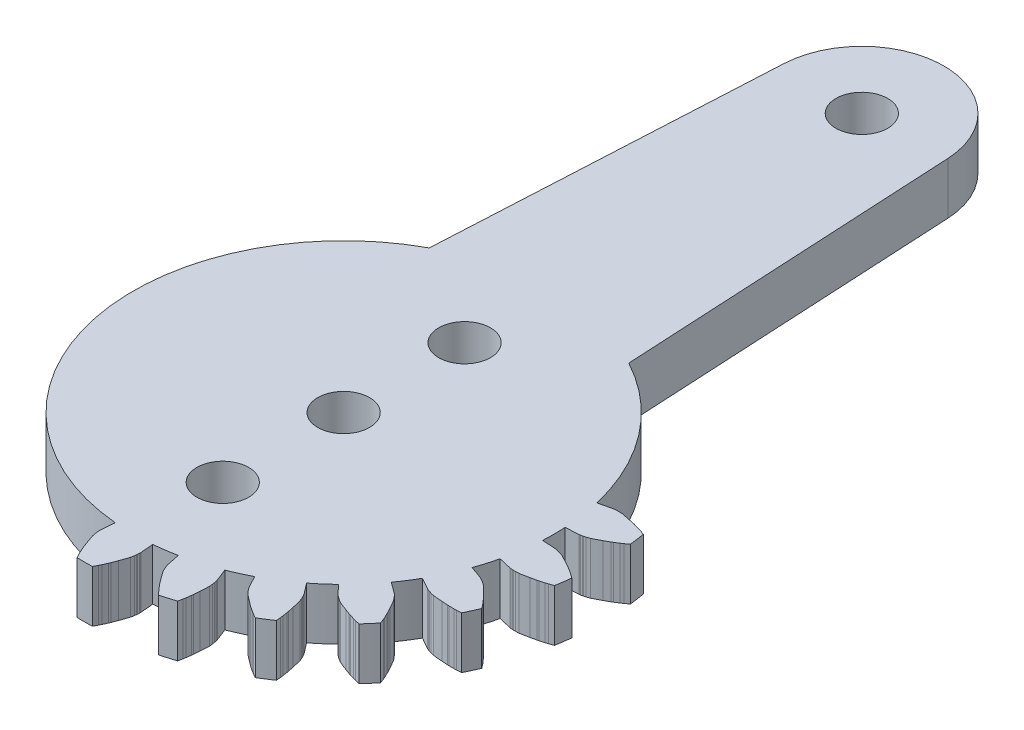
from build123d import *

# Parameters (mm, degrees)
EXTRUDE_1_DEPTH          = 3
SKETCH_2_R               = 12.1875
SKETCH_2_R_2             = 1.5
EXTRUDE_2_DEPTH          = 3
PATTERN_CIRCULAR_2_COUNT = 22
SKETCH_5_R               = 1.5
EXTRUDE_3_DEPTH          = 3
CUT_EXTRUDE_1_DEPTH      = 3


with BuildPart() as part:
    # 草图1 → 凸台-拉伸1 (new body)
    with BuildSketch(Plane(origin=(0, 0, 0), x_dir=(1, 0, 0), z_dir=(0, 1, 0))):
        with BuildLine():
            Line((39.751048724, 40.522419067), (39.686554084, 41.267856945))
            Line((39.686554084, 41.267856945), (39.685130687, 41.328679419))
            Line((39.685130687, 41.328679419), (39.685864546, 41.357680475))
            Line((39.685864546, 41.357680475), (39.691646479, 41.452849434))
            Line((39.691646479, 41.452849434), (39.692944909, 41.469767126))
            Line((39.692944909, 41.469767126), (39.696597708, 41.504162575))
            Line((39.696597708, 41.504162575), (39.712000694, 41.625842063))
            Line((39.712000694, 41.625842063), (39.748222719, 41.824728347))
            ThreePointArc((39.748222719, 41.824728347), (39.836788564, 42.08141601), (39.929464983, 42.336648348))
            Line((39.929464983, 42.336648348), (40.043958498, 42.644244873))
            Line((40.043958498, 42.644244873), (40.045380324, 42.647784709))
            Line((40.045380324, 42.647784709), (40.085544561, 42.739845233))
            Line((40.085544561, 42.739845233), (40.199519113, 42.997146045))
            ThreePointArc((40.199519113, 42.997146045), (40.23147084, 43.066367201), (40.265346714, 43.134667321))
            ThreePointArc((40.265346714, 43.134667321), (40.328973011, 43.256230012), (40.394481299, 43.376788951))
            ThreePointArc((40.394481299, 43.376788951), (40.835680824, 43.383278913), (41.276880349, 43.376788932))
            ThreePointArc((41.276880349, 43.376788932), (41.342388638, 43.256229993), (41.406014935, 43.134667302))
            ThreePointArc((41.406014935, 43.134667302), (41.439890808, 43.066367181), (41.471842535, 42.997146026))
            Line((41.471842535, 42.997146026), (41.585817087, 42.739845214))
            Line((41.585817087, 42.739845214), (41.625981324, 42.647784689))
            Line((41.625981324, 42.647784689), (41.62740315, 42.644244854))
            Line((41.62740315, 42.644244854), (41.741896665, 42.336648329))
            ThreePointArc((41.741896665, 42.336648329), (41.834572754, 42.081415998), (41.923138271, 41.824728347))
            Line((41.923138271, 41.824728347), (41.959360296, 41.625842063))
            Line((41.959360296, 41.625842063), (41.974763282, 41.504162575))
            Line((41.974763282, 41.504162575), (41.978416081, 41.469767126))
            Line((41.978416081, 41.469767126), (41.979714511, 41.452849434))
            Line((41.979714511, 41.452849434), (41.985496444, 41.357680475))
            Line((41.985496444, 41.357680475), (41.986230303, 41.328679419))
            Line((41.986230303, 41.328679419), (41.984806906, 41.267856945))
            Line((41.984806906, 41.267856945), (41.920312266, 40.522419067))
            ThreePointArc((41.920312266, 40.522419067), (40.835680495, 40.570778645), (39.751048724, 40.522419067))
        make_face()
    extrude_1 = extrude(amount=EXTRUDE_1_DEPTH)

    # 草图2 → 凸台-拉伸2 (add)
    with BuildSketch(Plane.XZ):
        with Locations((40.835680495, -28.383278645)):
            Circle(SKETCH_2_R)
        with Locations((40.835680495, -28.383278645)):
            Circle(SKETCH_2_R_2, mode=Mode.SUBTRACT)
        with Locations((40.835680495, -21.383278645)):
            Circle(SKETCH_2_R_2, mode=Mode.SUBTRACT)
        with Locations((40.835680495, -35.383278645)):
            Circle(SKETCH_2_R_2, mode=Mode.SUBTRACT)
    extrude(amount=-EXTRUDE_2_DEPTH)

    # 阵列(圆周)2: 凸台-拉伸1 ×22 about axis
    pattern_circular_2_axis = Axis((40.835680495, 3, -28.383278645), (0, -1, 0))
    for i in range(1, PATTERN_CIRCULAR_2_COUNT):
        add(extrude_1.rotate(pattern_circular_2_axis, i * 360 / PATTERN_CIRCULAR_2_COUNT))

    # 草图5 → 凸台-拉伸3 (add)
    with BuildSketch(Plane.XZ):
        with BuildLine():
            Line((45.585680495, -58.632739942), (46.610680495, -39.115684305))
            ThreePointArc((46.610680495, -39.115684305), (40.835680495, -40.570778645), (35.060680495, -39.115684305))
            Line((35.060680495, -39.115684305), (36.085680495, -58.632739942))
            ThreePointArc((36.085680495, -58.632739942), (40.835680495, -63.13982476), (45.585680495, -58.632739942))
        make_face()
        with Locations((40.835680495, -58.383278645)):
            Circle(SKETCH_5_R, mode=Mode.SUBTRACT)
    extrude(amount=-EXTRUDE_3_DEPTH)

    # 草图7 → 切除-拉伸1 (cut)
    with BuildSketch(Plane.XZ):
        with BuildLine():
            Line((35.060680495, -39.115684305), (35.075125418, -39.390730508))
            Line((35.075125418, -39.390730508), (34.836458203, -39.843740301))
            Line((34.836458203, -39.843740301), (33.621076182, -45.069775655))
            Line((33.621076182, -45.069775655), (23.29469854, -35.421541283))
            Line((23.29469854, -35.421541283), (25.189109524, -22.168156693))
            Line((25.189109524, -22.168156693), (31.430752441, -11.204000881))
            Line((31.430752441, -11.204000881), (37.969616449, -9.816969122))
            Line((37.969616449, -9.816969122), (39.751048724, -16.244138224))
            ThreePointArc((39.751048724, -16.244138224), (28.89664611, -25.93488852), (35.060680495, -39.115684305))
        make_face()
        with BuildLine():
            Line((46.610680495, -39.115684305), (46.596235572, -39.390730508))
            Line((46.596235572, -39.390730508), (47.014217925, -42.363226189))
            Line((47.014217925, -42.363226189), (53.527706743, -41.712847694))
            Line((53.527706743, -41.712847694), (55.437535773, -32.439444059))
            Line((55.437535773, -32.439444059), (52.32840334, -32.439444059))
            ThreePointArc((52.32840334, -32.439444059), (50.09238666, -36.31098621), (46.610680495, -39.115684305))
        make_face()
    extrude(amount=-CUT_EXTRUDE_1_DEPTH, mode=Mode.SUBTRACT)


solid = part.part
